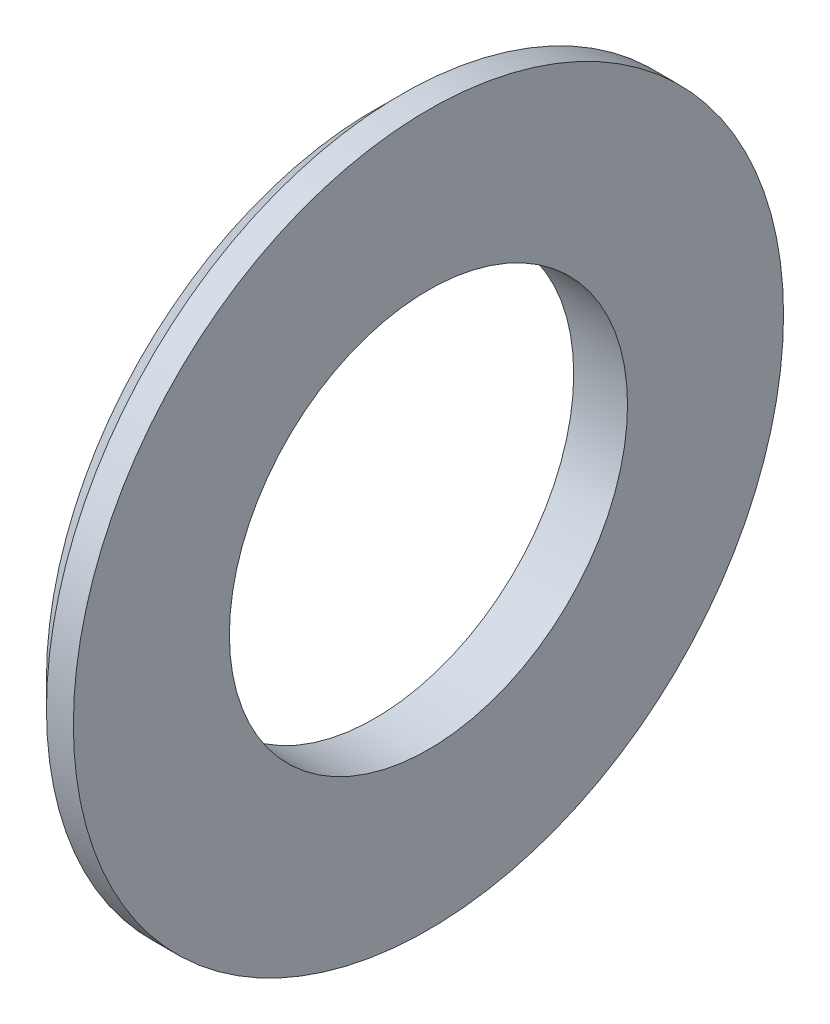
from build123d import *


with BuildPart() as part:
    # Sketch1 → Base-Revolve (revolve)
    with BuildSketch(Plane.XY):
        Polygon((0, 18.5), (0, 33), (-2.5, 33), (-5, 30.5), (-5, 18.5), align=None)
    revolve(axis=Axis((-34.925, 0, 0), (1, 0, 0)))


solid = part.part
